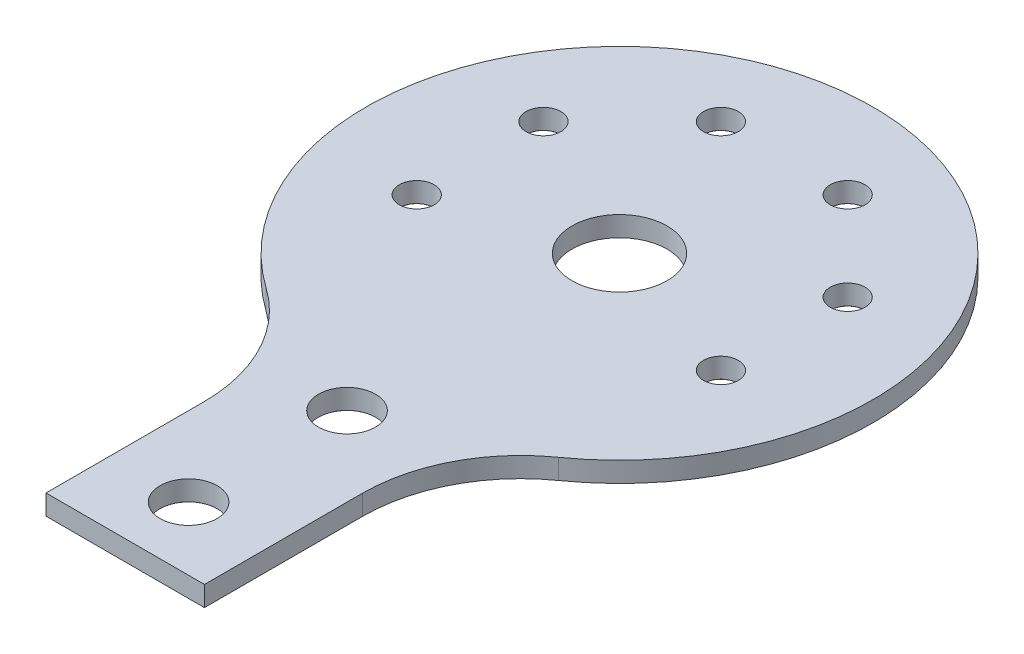
from build123d import *

# Parameters (mm, degrees)
BOSS_EXTRUDE1_DEPTH            = 3.175
SKETCH5_R                      = 7.5
CUT_EXTRUDE1_DEPTH             = 88.712983393
M8_CLEARANCE_HOLE1_AT_2_COUNT  = 2
M8_CLEARANCE_HOLE1_AT_2_PITCH  = 25
FILLET1_R                      = 25
M5_CLEARANCE_HOLE1_D           = 5.5
M5_CLEARANCE_HOLE1_CSINK_D     = 5.55
M5_CLEARANCE_HOLE1_CSINK_ANGLE = 90


with BuildPart() as part:
    # Sketch1 → Boss-Extrude1 (new body)
    with BuildSketch(Plane(origin=(0, 0, 0), x_dir=(1, 0, 0), z_dir=(0, 1, 0))):
        with BuildLine():
            Line((-12.5, -77.996710384), (12.5, -77.996710384))
            Line((12.5, -77.996710384), (12.5, -37.996710384))
            ThreePointArc((12.5, -37.996710384), (0, 40), (-12.5, -37.996710384))
            Line((-12.5, -37.996710384), (-12.5, -77.996710384))
        make_face()
    extrude(amount=BOSS_EXTRUDE1_DEPTH)

    # Sketch5 → Cut-Extrude1 (cut, through all)
    with BuildSketch(Plane.XZ):
        Circle(SKETCH5_R)
    extrude(amount=-CUT_EXTRUDE1_DEPTH, mode=Mode.SUBTRACT)

    # Sketch8 → M8 Clearance Hole1 (revolve, cut)
    with BuildSketch(Plane(origin=(0, 0, 42.996710384), x_dir=(0, 0, -1), z_dir=(1, 0, 0))):
        Polygon((0, 0), (0, 3.175), (4.5, 3.175), (4.5, 0.025), (4.525, 0), align=None)
    m8_clearance_hole1 = revolve(axis=Axis((0, -6.35, 42.996710384), (0, 1, 0)), mode=Mode.SUBTRACT)

    # M8 Clearance Hole1 at 2: M8 Clearance Hole1 ×2
    with Locations(*[(0, 0, i * M8_CLEARANCE_HOLE1_AT_2_PITCH) for i in range(1, M8_CLEARANCE_HOLE1_AT_2_COUNT)]):
        add(m8_clearance_hole1, mode=Mode.SUBTRACT)

    # Fillet1
    fillet1_edges = [part.edges().sort_by_distance(p)[0] for p in [
        (-12.5, 1.5875, 37.996710384),
        (12.5, 1.5875, 37.996710384),
    ]]
    fillet(fillet1_edges, radius=FILLET1_R)

    # M5 Clearance Hole1 (through all)
    with Locations(Plane(origin=(0, 0, 0), x_dir=(-1, 0, 0), z_dir=(0, -1, 0))):
        with Locations((10, 26), (24, 12), (24, -8), (-10, 26), (-24, 12), (-24, -8)):
            CounterSinkHole(M5_CLEARANCE_HOLE1_D / 2, M5_CLEARANCE_HOLE1_CSINK_D / 2, counter_sink_angle=M5_CLEARANCE_HOLE1_CSINK_ANGLE)


solid = part.part
